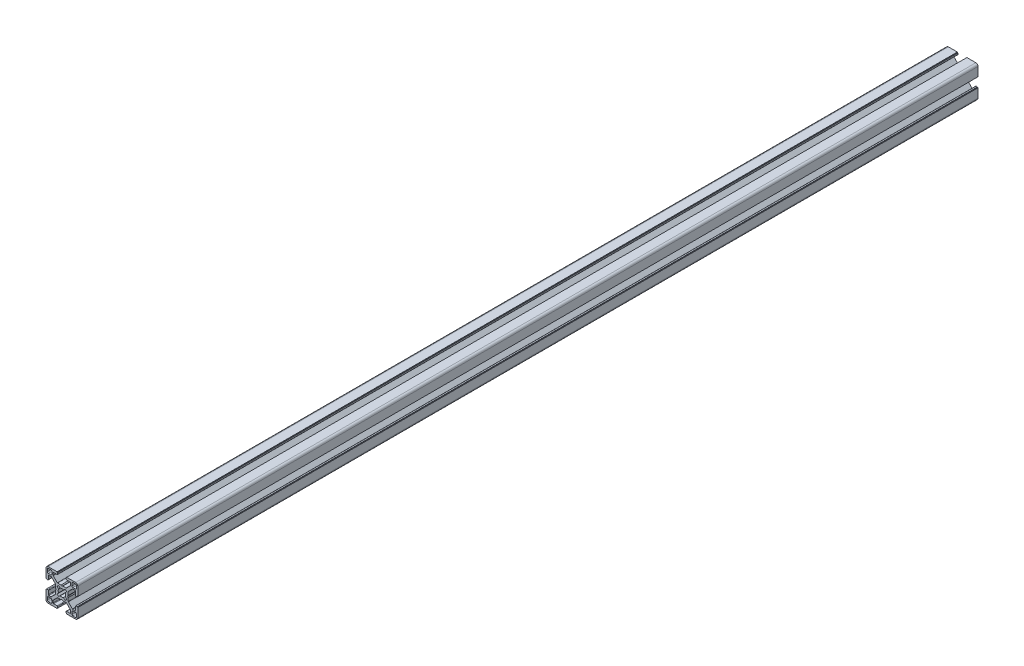
from build123d import *

# Parameters (mm, degrees)
BOSS_EXTRUDE1_DEPTH = 425
CIRPATTERN1_COUNT   = 4


with BuildPart() as part:
    # Sketch3 → Boss-Extrude1 (new, symmetric)
    with BuildSketch(Plane.XY):
        with BuildLine():
            Line((-4.503841895, 3.156803476), (-3.14772708, 1.530298739))
            ThreePointArc((-3.14772708, 1.530298739), (-3.410794979, 0.785160882), (-3.5, 0))
            Line((-3.5, 0), (-5.5, 0))
            Line((-5.5, 0), (-6, 0.866025404))
            Line((-6, 0.866025404), (-6, 3.996841995))
            ThreePointArc((-6, 3.996841995), (-6.038060234, 4.188183711), (-6.146446609, 4.350395385))
            Line((-6.146446609, 4.350395385), (-9.917104615, 8.121053391))
            ThreePointArc((-9.917104615, 8.121053391), (-10.079316289, 8.229439766), (-10.270658005, 8.2675))
            Line((-10.270658005, 8.2675), (-12.29, 8.2675))
            ThreePointArc((-12.29, 8.2675), (-12.643553391, 8.121053391), (-12.79, 7.7675))
            Line((-12.79, 7.7675), (-12.79, 4.5))
            ThreePointArc((-12.79, 4.5), (-12.936446609, 4.146446609), (-13.29, 4))
            Line((-13.29, 4), (-14.5, 4))
            Line((-14.5, 4), (-14.5, 4.5))
            Line((-14.5, 4.5), (-15, 4.5))
            Line((-15, 4.5), (-15, 12.968))
            ThreePointArc((-15, 12.968), (-14.404840979, 14.404840979), (-12.968, 15))
            Line((-12.968, 15), (-4.5, 15))
            Line((-4.5, 15), (-4.5, 14.5))
            Line((-4.5, 14.5), (-4, 14.5))
            Line((-4, 14.5), (-4, 13.29))
            ThreePointArc((-4, 13.29), (-4.146446609, 12.936446609), (-4.5, 12.79))
            Line((-4.5, 12.79), (-7.7675, 12.79))
            ThreePointArc((-7.7675, 12.79), (-8.121053391, 12.643553391), (-8.2675, 12.29))
            Line((-8.2675, 12.29), (-8.2675, 10.270658005))
            ThreePointArc((-8.2675, 10.270658005), (-8.229439766, 10.079316289), (-8.121053391, 9.917104615))
            Line((-8.121053391, 9.917104615), (-4.350395385, 6.146446609))
            ThreePointArc((-4.350395385, 6.146446609), (-4.188183711, 6.038060234), (-3.996841995, 6))
            Line((-3.996841995, 6), (-0.866025404, 6))
            Line((-0.866025404, 6), (0, 5.5))
            Line((0, 5.5), (0, 3.5))
            ThreePointArc((0, 3.5), (-0.785160882, 3.410794979), (-1.530298739, 3.14772708))
            Line((-1.530298739, 3.14772708), (-3.156803476, 4.503841895))
            ThreePointArc((-3.156803476, 4.503841895), (-3.889087297, 3.889087297), (-4.503841895, 3.156803476))
        make_face()
        with BuildLine():
            Line((-12.705, 9.5135), (-10.5135, 9.5135))
            ThreePointArc((-10.5135, 9.5135), (-9.806393219, 9.806393219), (-9.5135, 10.5135))
            Line((-9.5135, 10.5135), (-9.5135, 12.705))
            ThreePointArc((-9.5135, 12.705), (-9.806393219, 13.412106781), (-10.5135, 13.705))
            Line((-10.5135, 13.705), (-12.705, 13.705))
            ThreePointArc((-12.705, 13.705), (-13.412106781, 13.412106781), (-13.705, 12.705))
            Line((-13.705, 12.705), (-13.705, 10.5135))
            ThreePointArc((-13.705, 10.5135), (-13.412106781, 9.806393219), (-12.705, 9.5135))
        make_face(mode=Mode.SUBTRACT)
    boss_extrude1 = extrude(amount=BOSS_EXTRUDE1_DEPTH, both=True)

    # CirPattern1: Boss-Extrude1 ×4 about axis
    cirpattern1_axis = Axis((0, 0, 76.2), (0, 0, -1))
    for i in range(1, CIRPATTERN1_COUNT):
        add(boss_extrude1.rotate(cirpattern1_axis, i * 360 / CIRPATTERN1_COUNT))


solid = part.part
